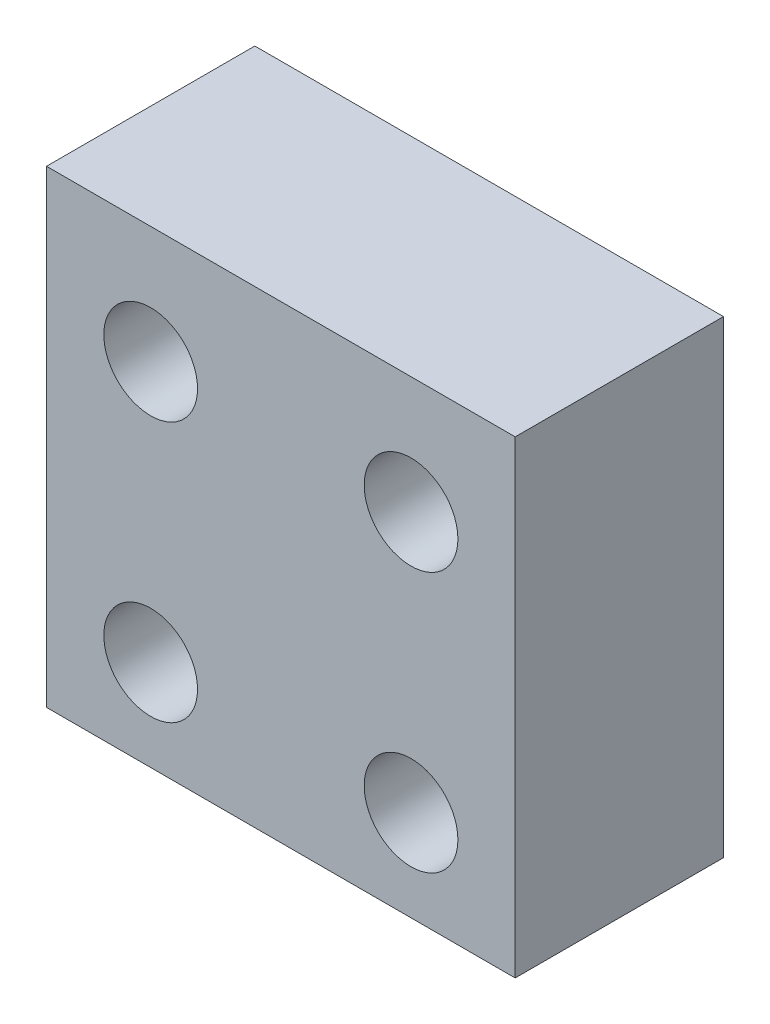
from build123d import *

# Parameters (mm, degrees)
SKETCH1_W            = 18
SKETCH1_H            = 18
BOSS_EXTRUDE1_DEPTH  = 8
M3_CLEARANCE_HOLE1_D = 3.6


with BuildPart() as part:
    # Sketch1 → Boss-Extrude1 (new body)
    with BuildSketch(Plane.XY):
        with Locations((160.000000073, 95.998999469)):
            Rectangle(SKETCH1_W, SKETCH1_H)
    extrude(amount=BOSS_EXTRUDE1_DEPTH)

    # M3 Clearance Hole1 (through all)
    with Locations(Plane.XY.offset(8)):
        with Locations((165.000000084, 90.498999424), (155.000000084, 90.498999456), (155.000000116, 100.498999456), (165.000000116, 100.498999424)):
            Hole(M3_CLEARANCE_HOLE1_D / 2)


solid = part.part
